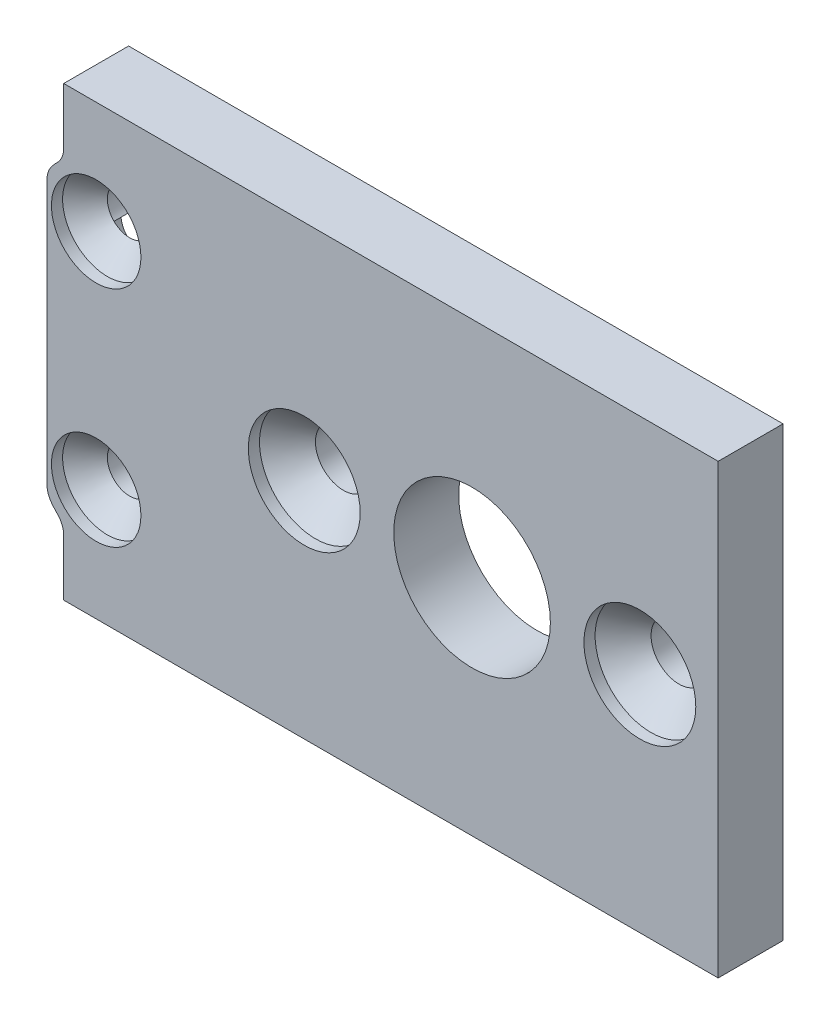
from build123d import *

# Parameters (mm, degrees)
SKETCH1_W                                      = 185
SKETCH1_H                                      = 20
BASE_SHAPE_DEPTH                               = 2.9
MOTOR_CUTOUTS_REACH                            = 95.084
SKETCH2_R                                      = 1.25
SKETCH2_R_2                                    = 3.5
SKETCH2_R_3                                    = 5
MOTOR_M2_5_COUNTERSUNKS_AT_2_COUNT             = 2
MOTOR_M2_5_COUNTERSUNKS_AT_2_PITCH             = 15
MOTOR_M2_5_COUNTERSUNKS_AT_3_COUNT             = 2
MOTOR_M2_5_COUNTERSUNKS_AT_3_PITCH             = 147.666008275
MOTOR_M2_5_COUNTERSUNKS_AT_4_COUNT             = 2
MOTOR_M2_5_COUNTERSUNKS_AT_4_PITCH             = 161.651631603
MOTOR_M2_5_COUNTERSUNKS_AT_5_COUNT             = 2
MOTOR_M2_5_COUNTERSUNKS_AT_5_PITCH             = 147.666008275
MOTOR_M2_5_COUNTERSUNKS_AT_6_COUNT             = 2
MOTOR_M2_5_COUNTERSUNKS_AT_6_PITCH             = 161.651631603
PCB_SLOT_DEPTH                                 = 0.775
END_PLATE_HOLES_REACH                          = 95.084
SKETCH6_R                                      = 1
CSK_FOR_M2_FLAT_HEAD_MACHINE_SCREW3_AT_2_COUNT = 2
CSK_FOR_M2_FLAT_HEAD_MACHINE_SCREW3_AT_2_PITCH = 10
CSK_FOR_M2_FLAT_HEAD_MACHINE_SCREW3_AT_3_COUNT = 2
CSK_FOR_M2_FLAT_HEAD_MACHINE_SCREW3_AT_3_PITCH = 180.6
CSK_FOR_M2_FLAT_HEAD_MACHINE_SCREW3_AT_4_COUNT = 2
CSK_FOR_M2_FLAT_HEAD_MACHINE_SCREW3_AT_4_PITCH = 180.876643047
TAP_START                                      = -1.4
TAP_SLOTS_DEPTH                                = 1.4
CUT_EXTRUDE3_REACH                             = 95.084
FILLET1_R                                      = 1
CUT_EXTRUDE4_REACH                             = 95.084
SKETCH14_W                                     = 155
SKETCH14_H                                     = 20


with BuildPart() as part:
    # Sketch1 → Base shape (new body)
    with BuildSketch(Plane.XY):
        Rectangle(SKETCH1_W, SKETCH1_H)
    extrude(amount=-BASE_SHAPE_DEPTH)

    # Sketch2 → Motor cutouts (cut, up to next)
    with BuildSketch(Plane.XY, mode=Mode.PRIVATE) as motor_cutouts_sk1:
        with Locations((-81, 0)):
            Circle(SKETCH2_R)
    motor_cutouts_tool1 = extrude(motor_cutouts_sk1.sketch, amount=-MOTOR_CUTOUTS_REACH, mode=Mode.PRIVATE) & part.part
    # Sketch2 → Motor cutouts (cut, up to next)
    with BuildSketch(Plane.XY, mode=Mode.PRIVATE) as motor_cutouts_sk2:
        with Locations((-66, 0)):
            Circle(SKETCH2_R)
    motor_cutouts_tool2 = extrude(motor_cutouts_sk2.sketch, amount=-MOTOR_CUTOUTS_REACH, mode=Mode.PRIVATE) & part.part
    # Sketch2 → Motor cutouts (cut, up to next)
    with BuildSketch(Plane.XY, mode=Mode.PRIVATE) as motor_cutouts_sk3:
        with Locations((-73.5, 0)):
            Circle(SKETCH2_R_2)
    motor_cutouts_tool3 = extrude(motor_cutouts_sk3.sketch, amount=-MOTOR_CUTOUTS_REACH, mode=Mode.PRIVATE) & part.part
    # Sketch2 → Motor cutouts (cut, up to next)
    with BuildSketch(Plane.XY, mode=Mode.PRIVATE) as motor_cutouts_sk4:
        with Locations((73.5, 0)):
            Circle(SKETCH2_R_3)
    motor_cutouts_tool4 = extrude(motor_cutouts_sk4.sketch, amount=-MOTOR_CUTOUTS_REACH, mode=Mode.PRIVATE) & part.part
    # Sketch2 → Motor cutouts (cut, up to next)
    with BuildSketch(Plane.XY, mode=Mode.PRIVATE) as motor_cutouts_sk5:
        with Locations((66.5, 7)):
            Circle(SKETCH2_R)
    motor_cutouts_tool5 = extrude(motor_cutouts_sk5.sketch, amount=-MOTOR_CUTOUTS_REACH, mode=Mode.PRIVATE) & part.part
    # Sketch2 → Motor cutouts (cut, up to next)
    with BuildSketch(Plane.XY, mode=Mode.PRIVATE) as motor_cutouts_sk6:
        with Locations((80.5, 7)):
            Circle(SKETCH2_R)
    motor_cutouts_tool6 = extrude(motor_cutouts_sk6.sketch, amount=-MOTOR_CUTOUTS_REACH, mode=Mode.PRIVATE) & part.part
    # Sketch2 → Motor cutouts (cut, up to next)
    with BuildSketch(Plane.XY, mode=Mode.PRIVATE) as motor_cutouts_sk7:
        with Locations((80.5, -7)):
            Circle(SKETCH2_R)
    motor_cutouts_tool7 = extrude(motor_cutouts_sk7.sketch, amount=-MOTOR_CUTOUTS_REACH, mode=Mode.PRIVATE) & part.part
    # Sketch2 → Motor cutouts (cut, up to next)
    with BuildSketch(Plane.XY, mode=Mode.PRIVATE) as motor_cutouts_sk8:
        with Locations((66.5, -7)):
            Circle(SKETCH2_R)
    motor_cutouts_tool8 = extrude(motor_cutouts_sk8.sketch, amount=-MOTOR_CUTOUTS_REACH, mode=Mode.PRIVATE) & part.part
    add(motor_cutouts_tool1.solids().sort_by_distance((-81, 0, 0))[0], mode=Mode.SUBTRACT)
    add(motor_cutouts_tool2.solids().sort_by_distance((-66, 0, 0))[0], mode=Mode.SUBTRACT)
    add(motor_cutouts_tool3.solids().sort_by_distance((-73.5, 0, 0))[0], mode=Mode.SUBTRACT)
    add(motor_cutouts_tool4.solids().sort_by_distance((73.5, 0, 0))[0], mode=Mode.SUBTRACT)
    add(motor_cutouts_tool5.solids().sort_by_distance((66.5, 7, 0))[0], mode=Mode.SUBTRACT)
    add(motor_cutouts_tool6.solids().sort_by_distance((80.5, 7, 0))[0], mode=Mode.SUBTRACT)
    add(motor_cutouts_tool7.solids().sort_by_distance((80.5, -7, 0))[0], mode=Mode.SUBTRACT)
    add(motor_cutouts_tool8.solids().sort_by_distance((66.5, -7, 0))[0], mode=Mode.SUBTRACT)

    # Sketch4 → Motor M2.5 countersunks (revolve, cut)
    with BuildSketch(Plane(origin=(-81, 0, 0), x_dir=(0, -1, 0), z_dir=(1, 0, 0))):
        Polygon((0, 0), (0, 2.9), (1.25, 2.9), (1.25, 1.75), (2.5, 0.5), (2.5, 0), align=None)
    motor_m2_5_countersunks = revolve(axis=Axis((-81, 0, 6.35), (0, 0, -1)), mode=Mode.SUBTRACT)

    # Motor M2.5 countersunks at 2: Motor M2.5 countersunks ×2
    with Locations(*[(i * MOTOR_M2_5_COUNTERSUNKS_AT_2_PITCH, 0, 0) for i in range(1, MOTOR_M2_5_COUNTERSUNKS_AT_2_COUNT)]):
        add(motor_m2_5_countersunks, mode=Mode.SUBTRACT)

    # Motor M2.5 countersunks at 3: Motor M2.5 countersunks ×2
    with Locations(*[Vector(0.9988757854473691, 0.047404274563603965, 0) * (i * MOTOR_M2_5_COUNTERSUNKS_AT_3_PITCH) for i in range(1, MOTOR_M2_5_COUNTERSUNKS_AT_3_COUNT)]):
        add(motor_m2_5_countersunks, mode=Mode.SUBTRACT)

    # Motor M2.5 countersunks at 4: Motor M2.5 countersunks ×2
    with Locations(*[Vector(0.9990619853213468, 0.043302996267798335, 0) * (i * MOTOR_M2_5_COUNTERSUNKS_AT_4_PITCH) for i in range(1, MOTOR_M2_5_COUNTERSUNKS_AT_4_COUNT)]):
        add(motor_m2_5_countersunks, mode=Mode.SUBTRACT)

    # Motor M2.5 countersunks at 5: Motor M2.5 countersunks ×2
    with Locations(*[Vector(0.9988757854473691, -0.04740427456360395, 0) * (i * MOTOR_M2_5_COUNTERSUNKS_AT_5_PITCH) for i in range(1, MOTOR_M2_5_COUNTERSUNKS_AT_5_COUNT)]):
        add(motor_m2_5_countersunks, mode=Mode.SUBTRACT)

    # Motor M2.5 countersunks at 6: Motor M2.5 countersunks ×2
    with Locations(*[Vector(0.9990619853213468, -0.0433029962677983, 0) * (i * MOTOR_M2_5_COUNTERSUNKS_AT_6_PITCH) for i in range(1, MOTOR_M2_5_COUNTERSUNKS_AT_6_COUNT)]):
        add(motor_m2_5_countersunks, mode=Mode.SUBTRACT)

    # Sketch5 → PCB slot (cut)
    with BuildSketch(Plane(origin=(0, 0, -2.9), x_dir=(-1, 0, 0), z_dir=(0, 0, -1))):
        with BuildLine():
            Line((-60, -6), (60, -6))
            ThreePointArc((60, -6), (61, -7), (60, -8))
            Line((60, -8), (-60, -8))
            ThreePointArc((-60, -8), (-61, -7), (-60, -6))
        make_face()
    extrude(amount=-PCB_SLOT_DEPTH, mode=Mode.SUBTRACT)

    # Sketch6 → End plate holes (cut, up to next)
    with BuildSketch(Plane.XY, mode=Mode.PRIVATE) as end_plate_holes_sk1:
        with Locations((90.3, 5)):
            Circle(SKETCH6_R)
    end_plate_holes_tool1 = extrude(end_plate_holes_sk1.sketch, amount=-END_PLATE_HOLES_REACH, mode=Mode.PRIVATE) & part.part
    # Sketch6 → End plate holes (cut, up to next)
    with BuildSketch(Plane.XY, mode=Mode.PRIVATE) as end_plate_holes_sk2:
        with Locations((90.3, -5)):
            Circle(SKETCH6_R)
    end_plate_holes_tool2 = extrude(end_plate_holes_sk2.sketch, amount=-END_PLATE_HOLES_REACH, mode=Mode.PRIVATE) & part.part
    # Sketch6 → End plate holes (cut, up to next)
    with BuildSketch(Plane.XY, mode=Mode.PRIVATE) as end_plate_holes_sk3:
        with Locations((-90.3, -5)):
            Circle(SKETCH6_R)
    end_plate_holes_tool3 = extrude(end_plate_holes_sk3.sketch, amount=-END_PLATE_HOLES_REACH, mode=Mode.PRIVATE) & part.part
    # Sketch6 → End plate holes (cut, up to next)
    with BuildSketch(Plane.XY, mode=Mode.PRIVATE) as end_plate_holes_sk4:
        with Locations((-90.3, 5)):
            Circle(SKETCH6_R)
    end_plate_holes_tool4 = extrude(end_plate_holes_sk4.sketch, amount=-END_PLATE_HOLES_REACH, mode=Mode.PRIVATE) & part.part
    add(end_plate_holes_tool1.solids().sort_by_distance((90.3, 5, 0))[0], mode=Mode.SUBTRACT)
    add(end_plate_holes_tool2.solids().sort_by_distance((90.3, -5, 0))[0], mode=Mode.SUBTRACT)
    add(end_plate_holes_tool3.solids().sort_by_distance((-90.3, -5, 0))[0], mode=Mode.SUBTRACT)
    add(end_plate_holes_tool4.solids().sort_by_distance((-90.3, 5, 0))[0], mode=Mode.SUBTRACT)

    # Sketch9 → CSK for M2 Flat Head Machine Screw3 (revolve, cut)
    with BuildSketch(Plane(origin=(90.3, 5, 0), x_dir=(0, -1, 0), z_dir=(1, 0, 0))):
        Polygon((0, 0), (0, 2.9), (1, 2.9), (1, 1.5), (2, 0.5), (2, 0), align=None)
    csk_for_m2_flat_head_machine_screw3 = revolve(axis=Axis((90.3, 5, 6.35), (0, 0, -1)), mode=Mode.SUBTRACT)

    # CSK for M2 Flat Head Machine Screw3 at 2: CSK for M2 Flat Head Machine Screw3 ×2
    with Locations(*[(0, -i * CSK_FOR_M2_FLAT_HEAD_MACHINE_SCREW3_AT_2_PITCH, 0) for i in range(1, CSK_FOR_M2_FLAT_HEAD_MACHINE_SCREW3_AT_2_COUNT)]):
        add(csk_for_m2_flat_head_machine_screw3, mode=Mode.SUBTRACT)

    # CSK for M2 Flat Head Machine Screw3 at 3: CSK for M2 Flat Head Machine Screw3 ×2
    with Locations(*[(-i * CSK_FOR_M2_FLAT_HEAD_MACHINE_SCREW3_AT_3_PITCH, 0, 0) for i in range(1, CSK_FOR_M2_FLAT_HEAD_MACHINE_SCREW3_AT_3_COUNT)]):
        add(csk_for_m2_flat_head_machine_screw3, mode=Mode.SUBTRACT)

    # CSK for M2 Flat Head Machine Screw3 at 4: CSK for M2 Flat Head Machine Screw3 ×2
    with Locations(*[Vector(-0.9984705430039356, -0.055286298062233535, 0) * (i * CSK_FOR_M2_FLAT_HEAD_MACHINE_SCREW3_AT_4_PITCH) for i in range(1, CSK_FOR_M2_FLAT_HEAD_MACHINE_SCREW3_AT_4_COUNT)]):
        add(csk_for_m2_flat_head_machine_screw3, mode=Mode.SUBTRACT)

    # Sketch12 → Tap slots (cut)
    with BuildSketch(Plane(origin=(0, 0, -2.9), x_dir=(-1, 0, 0), z_dir=(0, 0, -1)).offset(TAP_START)):
        with BuildLine():
            ThreePointArc((-91.003038379, 4.288848091), (-91.998627583, 3.716739018), (-91.8, 2.585786438))
            Line((-91.8, 2.585786438), (-91.8, -2.585786438))
            ThreePointArc((-91.8, -2.585786438), (-91.998627583, -3.716739018), (-91.003038379, -4.288848091))
            ThreePointArc((-91.003038379, -4.288848091), (-90.3, -6), (-89.596961621, -4.288848091))
            ThreePointArc((-89.596961621, -4.288848091), (-88.601372417, -3.716739018), (-88.8, -2.585786438))
            Line((-88.8, -2.585786438), (-88.8, 2.585786438))
            ThreePointArc((-88.8, 2.585786438), (-88.601372417, 3.716739018), (-89.596961621, 4.288848091))
            ThreePointArc((-89.596961621, 4.288848091), (-90.3, 6), (-91.003038379, 4.288848091))
        make_face()
        with BuildLine():
            ThreePointArc((91.003038379, -4.288848091), (91.998627583, -3.716739018), (91.8, -2.585786438))
            Line((91.8, -2.585786438), (91.8, 2.585786438))
            ThreePointArc((91.8, 2.585786438), (91.998627583, 3.716739018), (91.003038379, 4.288848091))
            ThreePointArc((91.003038379, 4.288848091), (90.3, 6), (89.596961621, 4.288848091))
            ThreePointArc((89.596961621, 4.288848091), (88.601372417, 3.716739018), (88.8, 2.585786438))
            Line((88.8, 2.585786438), (88.8, -2.585786438))
            ThreePointArc((88.8, -2.585786438), (88.601372417, -3.716739018), (89.596961621, -4.288848091))
            ThreePointArc((89.596961621, -4.288848091), (90.3, -6), (91.003038379, -4.288848091))
        make_face()
    extrude(amount=TAP_SLOTS_DEPTH, mode=Mode.SUBTRACT)

    # Sketch13 → Cut-Extrude3 (cut, up to next)
    with BuildSketch(Plane.XY, mode=Mode.PRIVATE) as cut_extrude3_sk1:
        with BuildLine():
            Line((-91.75, 10), (-92.5, 10))
            Line((-92.5, 10), (-92.5, 6.187434209))
            ThreePointArc((-92.5, 6.187434209), (-92.173731748, 6.655031521), (-91.75, 7.036541185))
            Line((-91.75, 7.036541185), (-91.75, 10))
        make_face()
    cut_extrude3_tool1 = extrude(cut_extrude3_sk1.sketch, amount=-CUT_EXTRUDE3_REACH, mode=Mode.PRIVATE) & part.part
    # Sketch13 → Cut-Extrude3 (cut, up to next)
    with BuildSketch(Plane.XY, mode=Mode.PRIVATE) as cut_extrude3_sk2:
        with BuildLine():
            Line((92.5, 10), (91.75, 10))
            Line((91.75, 10), (91.75, 7.036541185))
            ThreePointArc((91.75, 7.036541185), (92.173731748, 6.655031521), (92.5, 6.187434209))
            Line((92.5, 6.187434209), (92.5, 10))
        make_face()
    cut_extrude3_tool2 = extrude(cut_extrude3_sk2.sketch, amount=-CUT_EXTRUDE3_REACH, mode=Mode.PRIVATE) & part.part
    # Sketch13 → Cut-Extrude3 (cut, up to next)
    with BuildSketch(Plane.XY, mode=Mode.PRIVATE) as cut_extrude3_sk3:
        with BuildLine():
            ThreePointArc((-91.75, -7.036541185), (-92.173731748, -6.655031521), (-92.5, -6.187434209))
            Line((-92.5, -6.187434209), (-92.5, -10))
            Line((-92.5, -10), (-91.75, -10))
            Line((-91.75, -10), (-91.75, -7.036541185))
        make_face()
    cut_extrude3_tool3 = extrude(cut_extrude3_sk3.sketch, amount=-CUT_EXTRUDE3_REACH, mode=Mode.PRIVATE) & part.part
    # Sketch13 → Cut-Extrude3 (cut, up to next)
    with BuildSketch(Plane.XY, mode=Mode.PRIVATE) as cut_extrude3_sk4:
        with BuildLine():
            ThreePointArc((92.5, -6.187434209), (92.173731748, -6.655031521), (91.75, -7.036541185))
            Line((91.75, -7.036541185), (91.75, -10))
            Line((91.75, -10), (92.5, -10))
            Line((92.5, -10), (92.5, -6.187434209))
        make_face()
    cut_extrude3_tool4 = extrude(cut_extrude3_sk4.sketch, amount=-CUT_EXTRUDE3_REACH, mode=Mode.PRIVATE) & part.part
    add(cut_extrude3_tool1.solids().sort_by_distance((-92.140588, 8.330084, 0))[0], mode=Mode.SUBTRACT)
    add(cut_extrude3_tool2.solids().sort_by_distance((92.140588, 8.330084, 0))[0], mode=Mode.SUBTRACT)
    add(cut_extrude3_tool3.solids().sort_by_distance((-92.140588, -8.330084, 0))[0], mode=Mode.SUBTRACT)
    add(cut_extrude3_tool4.solids().sort_by_distance((92.140588, -8.330084, 0))[0], mode=Mode.SUBTRACT)

    # Fillet1
    fillet1_edges = [part.edges().sort_by_distance(p)[0] for p in [
        (-91.75, -7.036541185, -1.45),
        (-92.5, -6.187434209, -1.45),
        (-92.5, 6.187434209, -1.45),
        (-91.75, 7.036541185, -1.45),
        (92.5, 6.187434209, -1.45),
        (91.75, 7.036541185, -1.45),
        (92.5, -6.187434209, -1.45),
        (91.75, -7.036541185, -1.45),
    ]]
    fillet(fillet1_edges, radius=FILLET1_R)

    # Sketch14 → Cut-Extrude4 (cut, up to next)
    with BuildSketch(Plane.XY, mode=Mode.PRIVATE) as cut_extrude4_sk1:
        with Locations((15, 0)):
            Rectangle(SKETCH14_W, SKETCH14_H)
    cut_extrude4_tool1 = extrude(cut_extrude4_sk1.sketch, amount=-CUT_EXTRUDE4_REACH, mode=Mode.PRIVATE) & part.part
    add(cut_extrude4_tool1.solids().sort_by_distance((15, 0, 0))[0], mode=Mode.SUBTRACT)


solid = part.part
